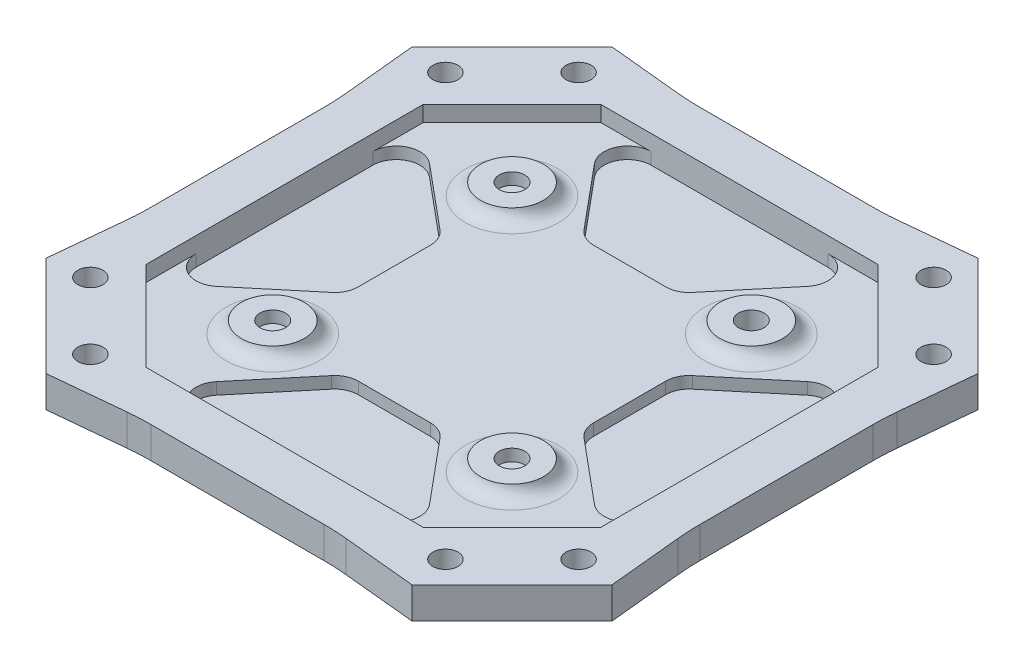
from build123d import *

# Parameters (mm, degrees)
SKETCH1_R           = 1.6
BOSS_EXTRUDE2_DEPTH = 4
CUT_EXTRUDE1_DEPTH  = 2
CUT_EXTRUDE2_DEPTH  = 1.5
SKETCH4_R           = 1.625
CUT_EXTRUDE3_DEPTH  = 52.039200621
BOSS_EXTRUDE3_START = 1.5
SKETCH5_R           = 4
SKETCH5_R_2         = 1.625
BOSS_EXTRUDE3_DEPTH = 1.5
CIRPATTERN1_COUNT   = 4
FILLET1_R           = 2
FILLET2_R           = 30


with BuildPart() as part:
    # Sketch1 → Boss-Extrude2 (new body)
    with BuildSketch(Plane(origin=(0, 0, 0), x_dir=(1, 0, 0), z_dir=(0, 1, 0))):
        Polygon((-12.5, 35), (12.5, 35), (23.334523779, 36.062445841), (36.062445841, 23.334523779), (35, 12.5), (35, -12.5), (36.062445841, -23.334523779), (23.334523779, -36.062445841), (12.5, -35), (-12.5, -35), (-23.334523779, -36.062445841), (-36.062445841, -23.334523779), (-35, -12.5), (-35, 12.5), (-36.062445841, 23.334523779), (-23.334523779, 36.062445841), align=None)
        with Locations(Location((22.627416998, 31.112698372, 0), (0, 0, 270))):
            Circle(SKETCH1_R, mode=Mode.SUBTRACT)
        with Locations(Location((31.112698372, 22.627416998, 0), (0, 0, 270))):
            Circle(SKETCH1_R, mode=Mode.SUBTRACT)
        with Locations(Location((22.627416998, -31.112698372, 0), (0, 0, 270))):
            Circle(SKETCH1_R, mode=Mode.SUBTRACT)
        with Locations(Location((31.112698372, -22.627416998, 0), (0, 0, 270))):
            Circle(SKETCH1_R, mode=Mode.SUBTRACT)
        with Locations(Location((-31.112698372, -22.627416998, 0), (0, 0, 270))):
            Circle(SKETCH1_R, mode=Mode.SUBTRACT)
        with Locations(Location((-22.627416998, -31.112698372, 0), (0, 0, 270))):
            Circle(SKETCH1_R, mode=Mode.SUBTRACT)
        with Locations(Location((-22.627416998, 31.112698372, 0), (0, 0, 270))):
            Circle(SKETCH1_R, mode=Mode.SUBTRACT)
        with Locations(Location((-31.112698372, 22.627416998, 0), (0, 0, 270))):
            Circle(SKETCH1_R, mode=Mode.SUBTRACT)
    extrude(amount=BOSS_EXTRUDE2_DEPTH)

    # Sketch2 → Cut-Extrude1 (cut)
    with BuildSketch(Plane(origin=(0, 4, 0), x_dir=(1, 0, 0), z_dir=(0, 1, 0))):
        Polygon((-17.669047558, 29), (17.669047558, 29), (29, 17.669047558), (29, -17.669047558), (17.669047558, -29), (-17.669047558, -29), (-29, -17.669047558), (-29, 17.669047558), align=None)
    extrude(amount=-CUT_EXTRUDE1_DEPTH, mode=Mode.SUBTRACT)

    # Sketch3 → Cut-Extrude2 (cut)
    with BuildSketch(Plane(origin=(0, 2, 0), x_dir=(1, 0, 0), z_dir=(0, 1, 0))):
        with BuildLine():
            Line((-24.079215521, 13.567556979), (-16.079215521, 6.899529803))
            ThreePointArc((-16.079215521, 6.899529803), (-15.283167889, 5.867388581), (-15, 4.595058717))
            Line((-15, 4.595058717), (-15, -4.595058717))
            ThreePointArc((-15, -4.595058717), (-15.283167889, -5.867388581), (-16.079215521, -6.899529803))
            Line((-16.079215521, -6.899529803), (-24.079215521, -13.567556979))
            ThreePointArc((-24.079215521, -13.567556979), (-27.272329864, -13.979918004), (-29, -11.263085893))
            Line((-29, -11.263085893), (-29, 11.263085893))
            ThreePointArc((-29, 11.263085893), (-27.272329864, 13.979918004), (-24.079215521, 13.567556979))
        make_face()
        with BuildLine():
            Line((13.567556979, 24.079215521), (6.899529803, 16.079215521))
            ThreePointArc((6.899529803, 16.079215521), (5.867388581, 15.283167889), (4.595058717, 15))
            Line((4.595058717, 15), (-4.595058717, 15))
            ThreePointArc((-4.595058717, 15), (-5.867388581, 15.283167889), (-6.899529803, 16.079215521))
            Line((-6.899529803, 16.079215521), (-13.567556979, 24.079215521))
            ThreePointArc((-13.567556979, 24.079215521), (-13.979918004, 27.272329864), (-11.263085893, 29))
            Line((-11.263085893, 29), (11.263085893, 29))
            ThreePointArc((11.263085893, 29), (13.979918004, 27.272329864), (13.567556979, 24.079215521))
        make_face()
        with BuildLine():
            Line((24.079215521, -13.567556979), (16.079215521, -6.899529803))
            ThreePointArc((16.079215521, -6.899529803), (15.283167889, -5.867388581), (15, -4.595058717))
            Line((15, -4.595058717), (15, 4.595058717))
            ThreePointArc((15, 4.595058717), (15.283167889, 5.867388581), (16.079215521, 6.899529803))
            Line((16.079215521, 6.899529803), (24.079215521, 13.567556979))
            ThreePointArc((24.079215521, 13.567556979), (27.272329864, 13.979918004), (29, 11.263085893))
            Line((29, 11.263085893), (29, -11.263085893))
            ThreePointArc((29, -11.263085893), (27.272329864, -13.979918004), (24.079215521, -13.567556979))
        make_face()
        with BuildLine():
            Line((-13.567556979, -24.079215521), (-6.899529803, -16.079215521))
            ThreePointArc((-6.899529803, -16.079215521), (-5.867388581, -15.283167889), (-4.595058717, -15))
            Line((-4.595058717, -15), (4.595058717, -15))
            ThreePointArc((4.595058717, -15), (5.867388581, -15.283167889), (6.899529803, -16.079215521))
            Line((6.899529803, -16.079215521), (13.567556979, -24.079215521))
            ThreePointArc((13.567556979, -24.079215521), (13.979918004, -27.272329864), (11.263085893, -29))
            Line((11.263085893, -29), (-11.263085893, -29))
            ThreePointArc((-11.263085893, -29), (-13.979918004, -27.272329864), (-13.567556979, -24.079215521))
        make_face()
    extrude(amount=-CUT_EXTRUDE2_DEPTH, mode=Mode.SUBTRACT)

    # Sketch4 → Cut-Extrude3 (cut, through all)
    with BuildSketch(Plane(origin=(0, 2, 0), x_dir=(1, 0, 0), z_dir=(0, 1, 0))):
        with Locations(Location((15.25, 15.25, 0), (0, 0, 270))):
            Circle(SKETCH4_R)
    extrude(amount=-CUT_EXTRUDE3_DEPTH, mode=Mode.SUBTRACT)

    # Sketch5 → Boss-Extrude3 (add)
    with BuildSketch(Plane(origin=(0, 2, 0), x_dir=(1, 0, 0), z_dir=(0, 1, 0)).offset(BOSS_EXTRUDE3_START)):
        with Locations(Location((15.25, 15.25, 0), (0, 0, 90))):
            Circle(SKETCH5_R)
        with Locations(Location((15.25, 15.25, 0), (0, 0, 270))):
            Circle(SKETCH5_R_2, mode=Mode.SUBTRACT)
    boss_extrude3 = extrude(amount=-BOSS_EXTRUDE3_DEPTH)

    # CirPattern1: Boss-Extrude3 ×4 about axis
    cirpattern1_axis = Axis((0, 0, 0), (0, 1, 0))
    for i in range(1, CIRPATTERN1_COUNT):
        add(boss_extrude3.rotate(cirpattern1_axis, i * 360 / CIRPATTERN1_COUNT))

    # Fillet1
    # the kernel refuses this fillet: 2 mm, written as the material it adds along each edge
    with BuildSketch(Plane(origin=(15.25, 2, -15.25), x_dir=(0, 0, -1), z_dir=(1, 0, 0))) as fillet1_piece_1:
        with BuildLine():
            CenterArc((5.936491673, 2), FILLET1_R, 194.477512186, 75.522487814)
            Line((4, 1.5), (3.961270167, 1.49))
            ThreePointArc((3.961270167, 1.49), (3.96, 0.75), (3.96, 0))
            Line((3.96, 0), (4, -0.04))
            Line((4, -0.04), (5.936491673, -0.04))
            Line((5.936491673, -0.04), (5.936491673, 0))
        make_face()
    revolve(axis=Axis((15.25, 2, -15.25), (0, 1, 0)))
    with BuildSketch(Plane(origin=(15.25, 2, 15.25), x_dir=(1, 0, 0), z_dir=(0, 0, 1))) as fillet1_piece_2:
        with BuildLine():
            CenterArc((5.936491673, 2), FILLET1_R, 194.477512186, 75.522487814)
            Line((4, 1.5), (3.961270167, 1.49))
            ThreePointArc((3.961270167, 1.49), (3.96, 0.75), (3.96, 0))
            Line((3.96, 0), (4, -0.04))
            Line((4, -0.04), (5.936491673, -0.04))
            Line((5.936491673, -0.04), (5.936491673, 0))
        make_face()
    revolve(axis=Axis((15.25, 2, 15.25), (0, 1, 0)))
    with BuildSketch(Plane(origin=(-15.25, 2, 15.25), x_dir=(0, 0, 1), z_dir=(-1, 0, 0))) as fillet1_piece_3:
        with BuildLine():
            CenterArc((5.936491673, 2), FILLET1_R, 194.477512186, 75.522487814)
            Line((4, 1.5), (3.961270167, 1.49))
            ThreePointArc((3.961270167, 1.49), (3.96, 0.75), (3.96, 0))
            Line((3.96, 0), (4, -0.04))
            Line((4, -0.04), (5.936491673, -0.04))
            Line((5.936491673, -0.04), (5.936491673, 0))
        make_face()
    revolve(axis=Axis((-15.25, 2, 15.25), (0, 1, 0)))
    with BuildSketch(Plane(origin=(-15.25, 2, -15.25), x_dir=(-1, 0, 0), z_dir=(0, 0, -1))) as fillet1_piece_4:
        with BuildLine():
            CenterArc((5.936491673, 2), FILLET1_R, 194.477512186, 75.522487814)
            Line((4, 1.5), (3.961270167, 1.49))
            ThreePointArc((3.961270167, 1.49), (3.96, 0.75), (3.96, 0))
            Line((3.96, 0), (4, -0.04))
            Line((4, -0.04), (5.936491673, -0.04))
            Line((5.936491673, -0.04), (5.936491673, 0))
        make_face()
    revolve(axis=Axis((-15.25, 2, -15.25), (0, 1, 0)))

    # Fillet2
    # the kernel refuses this fillet: 30 mm, written as the material it adds along each edge
    with BuildSketch(Plane(origin=(-12.5, 0, -35), x_dir=(1, 0, 0), z_dir=(0, 1, 0)), Plane(origin=(-12.5, 0, 35), x_dir=(-0.995226405289247, 0, 0.09759304388655687), z_dir=(0, 1, 0)), Plane(origin=(-35, 0, 12.5), x_dir=(0, 0, -1), z_dir=(0, 1, 0)), Plane(origin=(-35, 0, -12.5), x_dir=(-0.09759304388656588, 0, -0.9952264052892461), z_dir=(0, 1, 0))) as fillet2_piece_1:
        with BuildLine():
            CenterArc((FILLET2_R * 0.0489132680017, FILLET2_R), FILLET2_R, 264.399415997, 5.600584003)
            Line((-FILLET2_R * 0.0486797758843, FILLET2_R * 0.0047735947107), (0, 0))
            Line((0, 0), (FILLET2_R * 0.0489132680017, 0))
        make_face()
    extrude(amount=4)
    with BuildSketch(Plane(origin=(12.5, 0, -35), x_dir=(-1, 0, 0), z_dir=(0, 1, 0)), Plane(origin=(35, 0, -12.5), x_dir=(0.09759304388597295, 0, -0.9952264052893043), z_dir=(0, 1, 0)), Plane(origin=(35, 0, 12.5), x_dir=(0, 0, -1), z_dir=(0, 1, 0)), Plane(origin=(12.5, 0, 35), x_dir=(0.9952264052893042, 0, 0.09759304388597305), z_dir=(0, 1, 0))) as fillet2_piece_2:
        with BuildLine():
            CenterArc((FILLET2_R * 0.048913268002, -FILLET2_R), FILLET2_R, 90, 5.600584003)
            Line((-FILLET2_R * 0.0486797758846, -FILLET2_R * 0.00477359471075), (0, 0))
            Line((0, 0), (FILLET2_R * 0.048913268002, 0))
        make_face()
    extrude(amount=4)


solid = part.part
